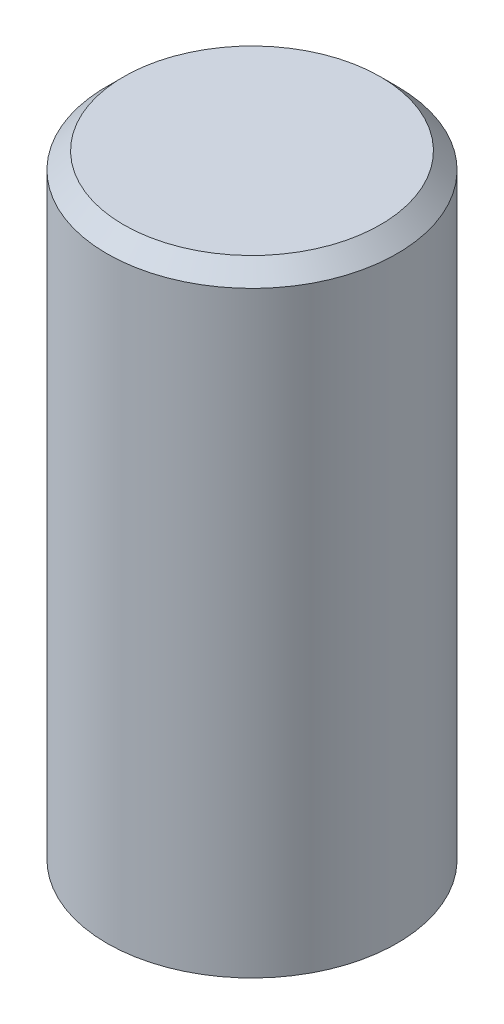
from build123d import *

# Parameters (mm, degrees)
SKETCH1_R           = 6
BOSS_EXTRUDE1_DEPTH = 25.4


# Read off the part's stored shape, not the designer's step: M12x1.25 Machine Threads Stud1
with BuildPart() as part:
    # Sketch1 → Boss-Extrude1 (new body)
    with BuildSketch(Plane(origin=(0, 0, 0), x_dir=(1, 0, 0), z_dir=(0, 1, 0))):
        with Locations(Location((0, 0, 0), (0, 0, 270))):
            Circle(SKETCH1_R)
    extrude(amount=BOSS_EXTRUDE1_DEPTH)

    # M12x1.25 Machine Threads Stud1 outline → M12x1.25 Machine Threads Stud1 (revolve, cut)
    with BuildSketch(Plane.XY):
        Polygon((6, 25.4), (5.3095, 25.4), (6, 24.7095), align=None)
    revolve(axis=Axis((0, 0, 0), (0, 1, 0)), mode=Mode.SUBTRACT)


solid = part.part
